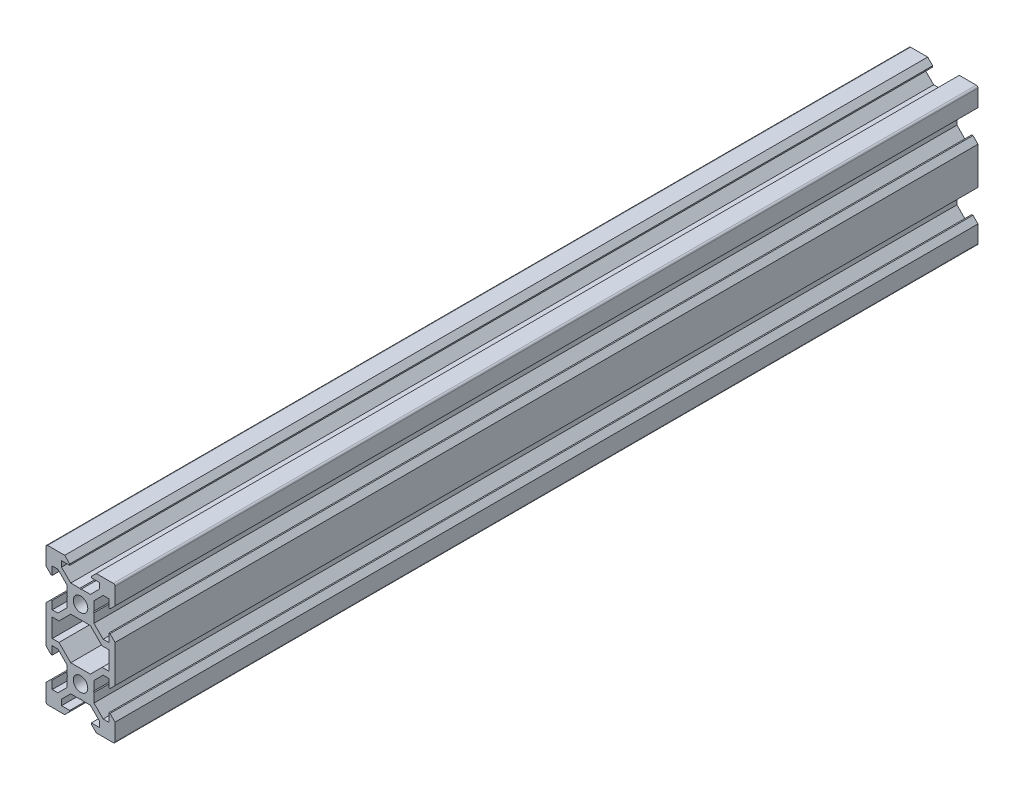
from build123d import *

# Parameters (mm, degrees)
ESBO_O1_R                = 2.1
RESSALTO_EXTRUS_O1_DEPTH = 250


with BuildPart() as part:
    # Esboço1 → Ressalto-extrusão1 (new body)
    with BuildSketch(Plane.XY):
        with BuildLine():
            Line((3.9, 9.79), (3.69, 10))
            Line((3.69, 10), (3.9, 10.21))
            Line((3.9, 10.21), (3.9, 12.839339828))
            Line((3.9, 12.839339828), (6.560660172, 15.5))
            Line((6.560660172, 15.5), (8.2, 15.5))
            Line((8.2, 15.5), (8.2, 13.125))
            Line((8.2, 13.125), (8.545, 13.125))
            Line((8.545, 13.125), (10, 14.58))
            Line((10, 14.58), (10, 19.5))
            ThreePointArc((10, 19.5), (9.853553391, 19.853553391), (9.5, 20))
            Line((9.5, 20), (4.58, 20))
            Line((4.58, 20), (3.125, 18.545))
            Line((3.125, 18.545), (3.125, 18.2))
            Line((3.125, 18.2), (5.5, 18.2))
            Line((5.5, 18.2), (5.5, 16.560660172))
            Line((5.5, 16.560660172), (2.839339828, 13.9))
            Line((2.839339828, 13.9), (0.21, 13.9))
            Line((0.21, 13.9), (0, 13.69))
            Line((0, 13.69), (-0.21, 13.9))
            Line((-0.21, 13.9), (-2.839339828, 13.9))
            Line((-2.839339828, 13.9), (-5.5, 16.560660172))
            Line((-5.5, 16.560660172), (-5.5, 18.2))
            Line((-5.5, 18.2), (-3.125, 18.2))
            Line((-3.125, 18.2), (-3.125, 18.545))
            Line((-3.125, 18.545), (-4.58, 20))
            Line((-4.58, 20), (-9.5, 20))
            ThreePointArc((-9.5, 20), (-9.853553391, 19.853553391), (-10, 19.5))
            Line((-10, 19.5), (-10, 14.58))
            Line((-10, 14.58), (-8.545, 13.125))
            Line((-8.545, 13.125), (-8.2, 13.125))
            Line((-8.2, 13.125), (-8.2, 15.5))
            Line((-8.2, 15.5), (-6.560660172, 15.5))
            Line((-6.560660172, 15.5), (-3.9, 12.839339828))
            Line((-3.9, 12.839339828), (-3.9, 10.21))
            Line((-3.9, 10.21), (-3.69, 10))
            Line((-3.69, 10), (-3.9, 9.79))
            Line((-3.9, 9.79), (-3.9, 7.160660172))
            Line((-3.9, 7.160660172), (-6.560660172, 4.5))
            Line((-6.560660172, 4.5), (-8.2, 4.5))
            Line((-8.2, 4.5), (-8.2, 6.875))
            Line((-8.2, 6.875), (-8.545, 6.875))
            Line((-8.545, 6.875), (-10, 5.42))
            Line((-10, 5.42), (-10, -5.42))
            Line((-10, -5.42), (-8.545, -6.875))
            Line((-8.545, -6.875), (-8.2, -6.875))
            Line((-8.2, -6.875), (-8.2, -4.5))
            Line((-8.2, -4.5), (-6.560660172, -4.5))
            Line((-6.560660172, -4.5), (-3.9, -7.160660172))
            Line((-3.9, -7.160660172), (-3.9, -9.79))
            Line((-3.9, -9.79), (-3.69, -10))
            Line((-3.69, -10), (-3.9, -10.21))
            Line((-3.9, -10.21), (-3.9, -12.839339828))
            Line((-3.9, -12.839339828), (-6.560660172, -15.5))
            Line((-6.560660172, -15.5), (-8.2, -15.5))
            Line((-8.2, -15.5), (-8.2, -13.125))
            Line((-8.2, -13.125), (-8.545, -13.125))
            Line((-8.545, -13.125), (-10, -14.58))
            Line((-10, -14.58), (-10, -19.5))
            ThreePointArc((-10, -19.5), (-9.853553391, -19.853553391), (-9.5, -20))
            Line((-9.5, -20), (-4.58, -20))
            Line((-4.58, -20), (-3.125, -18.545))
            Line((-3.125, -18.545), (-3.125, -18.2))
            Line((-3.125, -18.2), (-5.5, -18.2))
            Line((-5.5, -18.2), (-5.5, -16.560660172))
            Line((-5.5, -16.560660172), (-2.839339828, -13.9))
            Line((-2.839339828, -13.9), (-0.21, -13.9))
            Line((-0.21, -13.9), (0, -13.69))
            Line((0, -13.69), (0.21, -13.9))
            Line((0.21, -13.9), (2.839339828, -13.9))
            Line((2.839339828, -13.9), (5.5, -16.560660172))
            Line((5.5, -16.560660172), (5.5, -18.2))
            Line((5.5, -18.2), (3.125, -18.2))
            Line((3.125, -18.2), (3.125, -18.545))
            Line((3.125, -18.545), (4.58, -20))
            Line((4.58, -20), (9.5, -20))
            ThreePointArc((9.5, -20), (9.853553391, -19.853553391), (10, -19.5))
            Line((10, -19.5), (10, -14.58))
            Line((10, -14.58), (8.545, -13.125))
            Line((8.545, -13.125), (8.2, -13.125))
            Line((8.2, -13.125), (8.2, -15.5))
            Line((8.2, -15.5), (6.560660172, -15.5))
            Line((6.560660172, -15.5), (3.9, -12.839339828))
            Line((3.9, -12.839339828), (3.9, -10.21))
            Line((3.9, -10.21), (3.69, -10))
            Line((3.69, -10), (3.9, -9.79))
            Line((3.9, -9.79), (3.9, -7.160660172))
            Line((3.9, -7.160660172), (6.560660172, -4.5))
            Line((6.560660172, -4.5), (8.2, -4.5))
            Line((8.2, -4.5), (8.2, -6.875))
            Line((8.2, -6.875), (8.545, -6.875))
            Line((8.545, -6.875), (10, -5.42))
            Line((10, -5.42), (10, 5.42))
            Line((10, 5.42), (8.545, 6.875))
            Line((8.545, 6.875), (8.2, 6.875))
            Line((8.2, 6.875), (8.2, 4.5))
            Line((8.2, 4.5), (6.560660172, 4.5))
            Line((6.560660172, 4.5), (3.9, 7.160660172))
            Line((3.9, 7.160660172), (3.9, 9.79))
        make_face()
        with Locations((0, -10)):
            Circle(ESBO_O1_R, mode=Mode.SUBTRACT)
        with Locations((0, 10)):
            Circle(ESBO_O1_R, mode=Mode.SUBTRACT)
        Polygon((8.2, -2.7), (8.2, 2.7), (6.239339828, 2.7), (2.839339828, 6.1), (-2.839339828, 6.1), (-6.239339828, 2.7), (-8.2, 2.7), (-8.2, -2.7), (-6.239339828, -2.7), (-2.839339828, -6.1), (2.839339828, -6.1), (6.239339828, -2.7), align=None, mode=Mode.SUBTRACT)
    extrude(amount=RESSALTO_EXTRUS_O1_DEPTH)


solid = part.part
